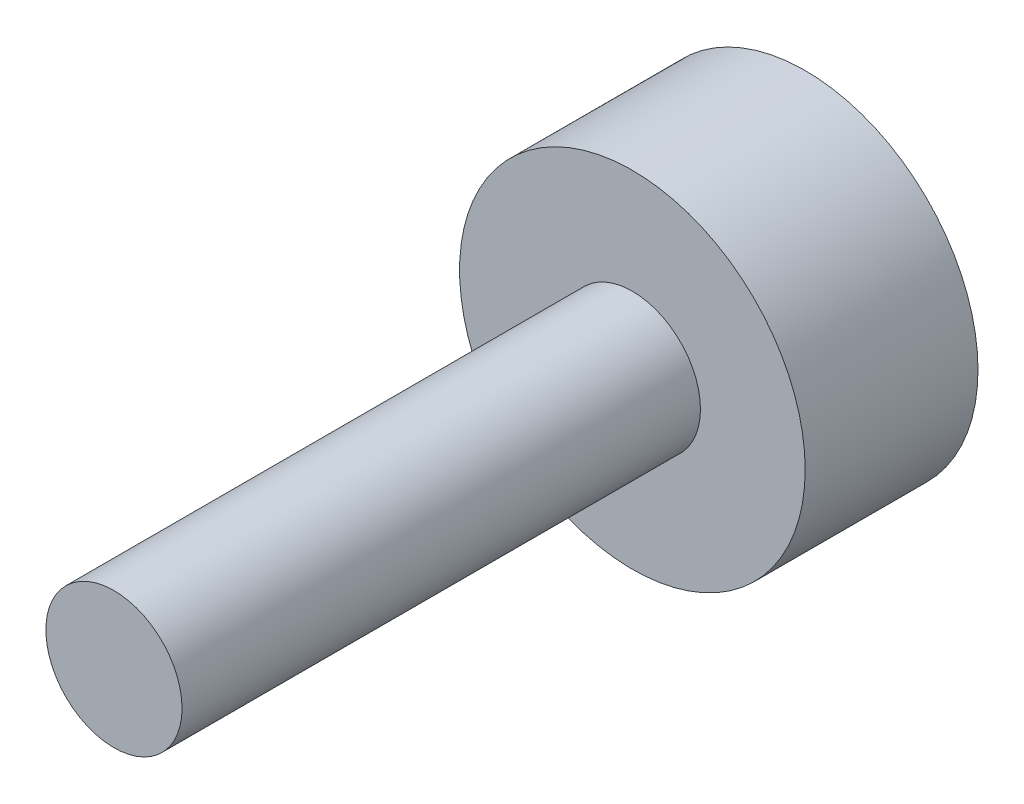
from build123d import *

# Parameters (mm, degrees)
SKETCH1_R           = 5
BOSS_EXTRUDE1_DEPTH = 2.5
SKETCH2_R           = 1.97
BOSS_EXTRUDE2_DEPTH = 15


with BuildPart() as part:
    # Sketch1 → Boss-Extrude1 (new, symmetric)
    with BuildSketch(Plane.XY):
        Circle(SKETCH1_R)
    extrude(amount=BOSS_EXTRUDE1_DEPTH, both=True)

    # Sketch2 → Boss-Extrude2 (add)
    with BuildSketch(Plane.XY.offset(2.5)):
        Circle(SKETCH2_R)
    extrude(amount=BOSS_EXTRUDE2_DEPTH)


solid = part.part
